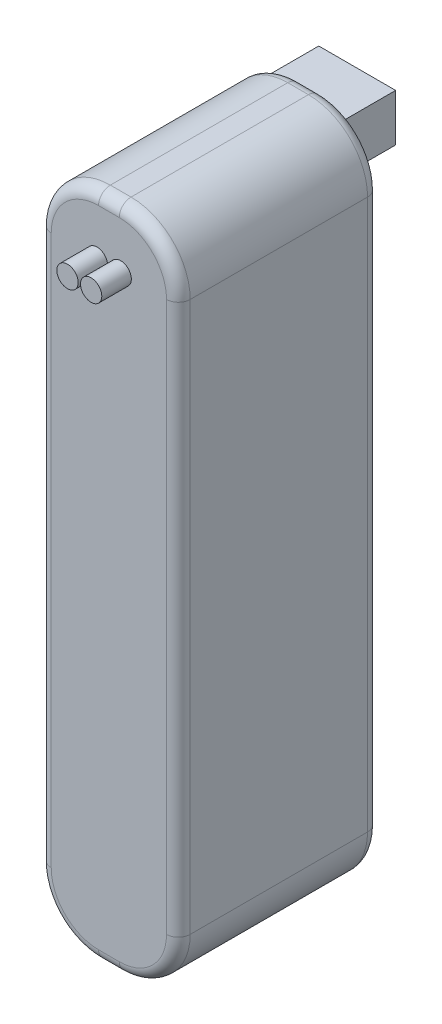
from build123d import *

# Parameters (mm, degrees)
SKETCH_1_W      = 23.5
SKETCH_1_H      = 34
EXTRUDE_1_DEPTH = 113
SKETCH_2_R      = 1.8
EXTRUDE_2_DEPTH = 5
SKETCH_3_W      = 13
SKETCH_3_H      = 8
EXTRUDE_3_DEPTH = 8
FILLET_1_R      = 10
FILLET_2_R      = 2


with BuildPart() as part:
    # ｽｹｯﾁ1 → ﾎﾞｽ - 押し出し1 (new body)
    with BuildSketch(Plane(origin=(0, 0, 0), x_dir=(1, 0, 0), z_dir=(0, 1, 0))):
        Rectangle(SKETCH_1_W, SKETCH_1_H)
    extrude(amount=EXTRUDE_1_DEPTH)

    # ｽｹｯﾁ2 → ﾎﾞｽ - 押し出し2 (add)
    with BuildSketch(Plane.XY.offset(17)):
        with Locations(Location((-2, 103, 0), (0, 0, 180))):
            Circle(SKETCH_2_R)
        with Locations(Location((2, 103, 0), (0, 0, 180))):
            Circle(SKETCH_2_R)
    extrude(amount=EXTRUDE_2_DEPTH)

    # ｽｹｯﾁ3 → ﾎﾞｽ - 押し出し3 (add)
    with BuildSketch(Plane(origin=(0, 0, -17), x_dir=(-1, 0, 0), z_dir=(0, 0, -1))):
        with Locations((0, 107)):
            Rectangle(SKETCH_3_W, SKETCH_3_H)
    extrude(amount=EXTRUDE_3_DEPTH)

    # ﾌｨﾚｯﾄ1
    fillet_1_edges = [part.edges().sort_by_distance(p)[0] for p in [
        (-11.75, 113, 0),
        (11.75, 113, 0),
        (-11.75, 0, 0),
        (11.75, 0, 0),
    ]]
    fillet(fillet_1_edges, radius=FILLET_1_R)

    # ﾌｨﾚｯﾄ2
    # the kernel refuses this fillet: 2 mm, written as the material it takes off along each edge
    with BuildSketch(Plane(origin=(11.75, 10, -17), x_dir=(-1, 0, 0), z_dir=(0, 1, 0)), Plane(origin=(11.75, 10, 17), x_dir=(0, 0, -1), z_dir=(0, 1, 0))) as fillet_2_piece_1:
        with BuildLine():
            CenterArc((FILLET_2_R, FILLET_2_R), FILLET_2_R, 180, 90)
            Line((0, FILLET_2_R), (0, 0))
            Line((0, 0), (FILLET_2_R, 0))
        make_face()
    extrude(amount=93, mode=Mode.SUBTRACT)
    with BuildSketch(Plane(origin=(-1.75, 0, -17), x_dir=(0, 1, 0), z_dir=(1, 0, 0)), Plane(origin=(1.75, 113, 17), x_dir=(0, 0, -1), z_dir=(-1, 0, 0))) as fillet_2_piece_2:
        with BuildLine():
            CenterArc((FILLET_2_R, FILLET_2_R), FILLET_2_R, 180, 90)
            Line((0, FILLET_2_R), (0, 0))
            Line((0, 0), (FILLET_2_R, 0))
        make_face()
    extrude(amount=3.5, mode=Mode.SUBTRACT)
    with BuildSketch(Plane(origin=(-11.75, 10, -17), x_dir=(1, 0, 0), z_dir=(0, 1, 0)), Plane(origin=(-11.75, 10, 17), x_dir=(0, 0, -1), z_dir=(0, 1, 0))) as fillet_2_piece_3:
        with BuildLine():
            CenterArc((FILLET_2_R, -FILLET_2_R), FILLET_2_R, 90, 90)
            Line((0, -FILLET_2_R), (0, 0))
            Line((0, 0), (FILLET_2_R, 0))
        make_face()
    extrude(amount=93, mode=Mode.SUBTRACT)
    with BuildSketch(Plane(origin=(-1.75, 113, -17), x_dir=(0, -1, 0), z_dir=(1, 0, 0)), Plane(origin=(1.75, 0, 17), x_dir=(0, 0, -1), z_dir=(-1, 0, 0))) as fillet_2_piece_4:
        with BuildLine():
            CenterArc((FILLET_2_R, -FILLET_2_R), FILLET_2_R, 90, 90)
            Line((0, -FILLET_2_R), (0, 0))
            Line((0, 0), (FILLET_2_R, 0))
        make_face()
    extrude(amount=3.5, mode=Mode.SUBTRACT)
    with BuildSketch(Plane(origin=(1.75, 103, -17), x_dir=(0, 1, 0), z_dir=(-1, 0, 0))) as fillet_2_piece_5_section:
        with BuildLine():
            CenterArc((10 - FILLET_2_R, -FILLET_2_R), FILLET_2_R, 0, 90)
            Line((10, -FILLET_2_R), (10, 0))
            Line((10, 0), (10 - FILLET_2_R, 0))
        make_face()
    fillet_2_piece_5 = revolve(axis=Axis((1.75, 103, -17), (0, 0, -1)), revolution_arc=90, mode=Mode.PRIVATE)
    fillet_2_piece_5 = split(fillet_2_piece_5, bisect_by=Plane(origin=(4.101759822, 111, -16.527412799), z_dir=(0, 1, 0)), keep=Keep.TOP, mode=Mode.PRIVATE)
    fillet_2_piece_5 = split(fillet_2_piece_5, bisect_by=Plane(origin=(6.5, 112.1945957, -16.527412799), z_dir=(-1, 0, 0)), keep=Keep.TOP, mode=Mode.PRIVATE)
    add(fillet_2_piece_5, mode=Mode.SUBTRACT)
    with BuildSketch(Plane(origin=(1.75, 103, -17), x_dir=(0, 1, 0), z_dir=(-1, 0, 0))) as fillet_2_piece_6_section:
        with BuildLine():
            CenterArc((10 - FILLET_2_R, -FILLET_2_R), FILLET_2_R, 0, 90)
            Line((10, -FILLET_2_R), (10, 0))
            Line((10, 0), (10 - FILLET_2_R, 0))
        make_face()
    fillet_2_piece_6 = revolve(axis=Axis((1.75, 103, -17), (0, 0, -1)), revolution_arc=90, mode=Mode.PRIVATE)
    fillet_2_piece_6 = split(fillet_2_piece_6, bisect_by=Plane(origin=(9.944543227, 111, -16.429177526), z_dir=(0, -1, 0)), keep=Keep.TOP, mode=Mode.PRIVATE)
    fillet_2_piece_6 = split(fillet_2_piece_6, bisect_by=Plane(origin=(6.5, 107.664638262, -16.429177526), z_dir=(1, 0, 0)), keep=Keep.TOP, mode=Mode.PRIVATE)
    add(fillet_2_piece_6, mode=Mode.SUBTRACT)
    with BuildSketch(Plane(origin=(1.75, 103, -17), x_dir=(0, 1, 0), z_dir=(-1, 0, 0))) as fillet_2_piece_7_section:
        with BuildLine():
            CenterArc((10 - FILLET_2_R, -FILLET_2_R), FILLET_2_R, 0, 90)
            Line((10, -FILLET_2_R), (10, 0))
            Line((10, 0), (10 - FILLET_2_R, 0))
        make_face()
    fillet_2_piece_7 = revolve(axis=Axis((1.75, 103, -17), (0, 0, -1)), revolution_arc=90, mode=Mode.PRIVATE)
    fillet_2_piece_7 = split(fillet_2_piece_7, bisect_by=Plane(origin=(6.999362203, 111, -16.337935444), z_dir=(0, 1, 0)), keep=Keep.TOP, mode=Mode.PRIVATE)
    fillet_2_piece_7 = split(fillet_2_piece_7, bisect_by=Plane(origin=(6.5, 111.322531281, -16.337935444), z_dir=(1, 0, 0)), keep=Keep.TOP, mode=Mode.PRIVATE)
    add(fillet_2_piece_7, mode=Mode.SUBTRACT)
    with BuildSketch(Plane(origin=(-1.75, 103, -17), x_dir=(-1, 0, 0), z_dir=(0, -1, 0))) as fillet_2_piece_8_section:
        with BuildLine():
            CenterArc((10 - FILLET_2_R, -FILLET_2_R), FILLET_2_R, 0, 90)
            Line((10, -FILLET_2_R), (10, 0))
            Line((10, 0), (10 - FILLET_2_R, 0))
        make_face()
    fillet_2_piece_8 = revolve(axis=Axis((-1.75, 103, -17), (0, 0, -1)), revolution_arc=90, mode=Mode.PRIVATE)
    fillet_2_piece_8 = split(fillet_2_piece_8, bisect_by=Plane(origin=(-6.5, 107.664638263, -16.429177529), z_dir=(-1, 0, 0)), keep=Keep.TOP, mode=Mode.PRIVATE)
    fillet_2_piece_8 = split(fillet_2_piece_8, bisect_by=Plane(origin=(-9.94454323, 111, -16.429177529), z_dir=(0, -1, 0)), keep=Keep.TOP, mode=Mode.PRIVATE)
    add(fillet_2_piece_8, mode=Mode.SUBTRACT)
    with BuildSketch(Plane(origin=(-1.75, 103, -17), x_dir=(-1, 0, 0), z_dir=(0, -1, 0))) as fillet_2_piece_9_section:
        with BuildLine():
            CenterArc((10 - FILLET_2_R, -FILLET_2_R), FILLET_2_R, 0, 90)
            Line((10, -FILLET_2_R), (10, 0))
            Line((10, 0), (10 - FILLET_2_R, 0))
        make_face()
    fillet_2_piece_9 = revolve(axis=Axis((-1.75, 103, -17), (0, 0, -1)), revolution_arc=90, mode=Mode.PRIVATE)
    fillet_2_piece_9 = split(fillet_2_piece_9, bisect_by=Plane(origin=(-6.5, 111.32253137, -16.337935534), z_dir=(-1, 0, 0)), keep=Keep.TOP, mode=Mode.PRIVATE)
    fillet_2_piece_9 = split(fillet_2_piece_9, bisect_by=Plane(origin=(-6.999362106, 111, -16.337935534), z_dir=(0, 1, 0)), keep=Keep.TOP, mode=Mode.PRIVATE)
    add(fillet_2_piece_9, mode=Mode.SUBTRACT)
    with BuildSketch(Plane(origin=(-1.75, 103, -17), x_dir=(-1, 0, 0), z_dir=(0, -1, 0))) as fillet_2_piece_10_section:
        with BuildLine():
            CenterArc((10 - FILLET_2_R, -FILLET_2_R), FILLET_2_R, 0, 90)
            Line((10, -FILLET_2_R), (10, 0))
            Line((10, 0), (10 - FILLET_2_R, 0))
        make_face()
    fillet_2_piece_10 = revolve(axis=Axis((-1.75, 103, -17), (0, 0, -1)), revolution_arc=90, mode=Mode.PRIVATE)
    fillet_2_piece_10 = split(fillet_2_piece_10, bisect_by=Plane(origin=(-6.5, 112.194595792, -16.527412821), z_dir=(1, 0, 0)), keep=Keep.TOP, mode=Mode.PRIVATE)
    fillet_2_piece_10 = split(fillet_2_piece_10, bisect_by=Plane(origin=(-4.101760011, 111, -16.527412821), z_dir=(0, 1, 0)), keep=Keep.TOP, mode=Mode.PRIVATE)
    add(fillet_2_piece_10, mode=Mode.SUBTRACT)
    with BuildSketch(Plane(origin=(-1.75, 10, -17), x_dir=(-1, 0, 0), z_dir=(0, 1, 0))) as fillet_2_piece_11:
        with BuildLine():
            CenterArc((10 - FILLET_2_R, FILLET_2_R), FILLET_2_R, 270, 90)
            Line((10, FILLET_2_R), (10, 0))
            Line((10, 0), (10 - FILLET_2_R, 0))
        make_face()
    revolve(axis=Axis((-1.75, 10, -17), (0, 0, 1)), revolution_arc=90, mode=Mode.SUBTRACT)
    with BuildSketch(Plane(origin=(1.75, 10, -17), x_dir=(0, -1, 0), z_dir=(-1, 0, 0))) as fillet_2_piece_12:
        with BuildLine():
            CenterArc((10 - FILLET_2_R, FILLET_2_R), FILLET_2_R, 270, 90)
            Line((10, FILLET_2_R), (10, 0))
            Line((10, 0), (10 - FILLET_2_R, 0))
        make_face()
    revolve(axis=Axis((1.75, 10, -17), (0, 0, 1)), revolution_arc=90, mode=Mode.SUBTRACT)
    with BuildSketch(Plane(origin=(1.75, 103, 17), x_dir=(0, 1, 0), z_dir=(-1, 0, 0))) as fillet_2_piece_13:
        with BuildLine():
            CenterArc((10 - FILLET_2_R, FILLET_2_R), FILLET_2_R, 270, 90)
            Line((10 - FILLET_2_R, 0), (10, 0))
            Line((10, 0), (10, FILLET_2_R))
        make_face()
    revolve(axis=Axis((1.75, 103, 17), (0, 0, -1)), revolution_arc=90, mode=Mode.SUBTRACT)
    with BuildSketch(Plane(origin=(-1.75, 103, 17), x_dir=(-1, 0, 0), z_dir=(0, -1, 0))) as fillet_2_piece_14:
        with BuildLine():
            CenterArc((10 - FILLET_2_R, FILLET_2_R), FILLET_2_R, 270, 90)
            Line((10 - FILLET_2_R, 0), (10, 0))
            Line((10, 0), (10, FILLET_2_R))
        make_face()
    revolve(axis=Axis((-1.75, 103, 17), (0, 0, -1)), revolution_arc=90, mode=Mode.SUBTRACT)
    with BuildSketch(Plane(origin=(-1.75, 10, 17), x_dir=(-1, 0, 0), z_dir=(0, 1, 0))) as fillet_2_piece_15:
        with BuildLine():
            CenterArc((10 - FILLET_2_R, -FILLET_2_R), FILLET_2_R, 0, 90)
            Line((10 - FILLET_2_R, 0), (10, 0))
            Line((10, 0), (10, -FILLET_2_R))
        make_face()
    revolve(axis=Axis((-1.75, 10, 17), (0, 0, 1)), revolution_arc=90, mode=Mode.SUBTRACT)
    with BuildSketch(Plane(origin=(1.75, 10, 17), x_dir=(0, -1, 0), z_dir=(-1, 0, 0))) as fillet_2_piece_16:
        with BuildLine():
            CenterArc((10 - FILLET_2_R, -FILLET_2_R), FILLET_2_R, 0, 90)
            Line((10 - FILLET_2_R, 0), (10, 0))
            Line((10, 0), (10, -FILLET_2_R))
        make_face()
    revolve(axis=Axis((1.75, 10, 17), (0, 0, 1)), revolution_arc=90, mode=Mode.SUBTRACT)


solid = part.part
